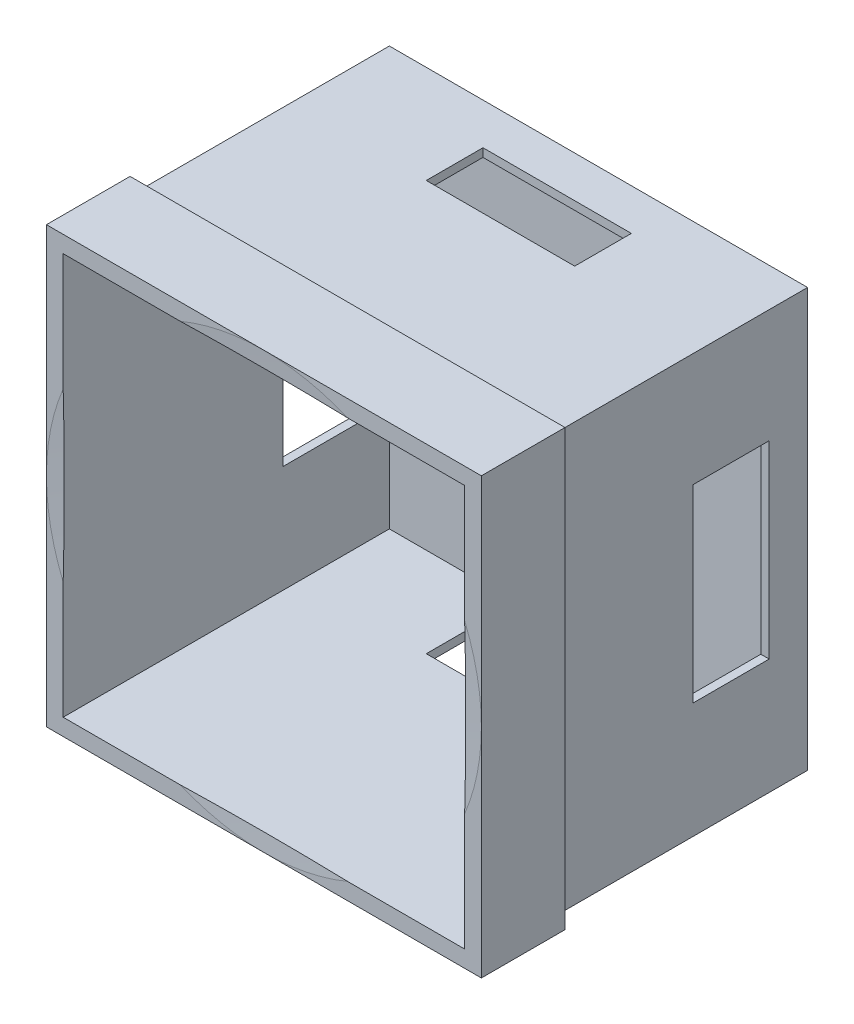
from build123d import *

# Parameters (mm, degrees)
SKETCH1_W           = 127
SKETCH1_H           = 76.2
BOSS_EXTRUDE1_DEPTH = 127
SHELL1_T            = -2.54
SKETCH2_W           = 132.08
SKETCH2_H           = 132.08
SKETCH2_W_2         = 121.92
SKETCH2_H_2         = 121.92
BOSS_EXTRUDE2_DEPTH = 25.4
SKETCH5_W           = 23.197534015
SKETCH5_H           = 57.422092124
CUT_EXTRUDE1_DEPTH  = 199.41286047
SKETCH6_W           = 45.064315034
SKETCH6_H           = 17.215386484
CUT_EXTRUDE2_DEPTH  = 199.41286047


with BuildPart() as part:
    # Sketch1 → Boss-Extrude1 (new body)
    with BuildSketch(Plane(origin=(0, 0, 0), x_dir=(1, 0, 0), z_dir=(0, 1, 0))):
        with Locations((-63.5, 38.1)):
            Rectangle(SKETCH1_W, SKETCH1_H)
    extrude(amount=BOSS_EXTRUDE1_DEPTH)

    # Shell1
    shell1_openings = [part.faces().sort_by_distance(p)[0] for p in [
        (-63.5, 63.5, 0),
    ]]
    offset(amount=SHELL1_T, openings=shell1_openings, kind=Kind.INTERSECTION)

    # Sketch2 → Boss-Extrude2 (add)
    with BuildSketch(Plane.XY):
        with Locations((-63.5, 63.5)):
            Rectangle(SKETCH2_W, SKETCH2_H)
        with Locations((-63.5, 63.5)):
            Rectangle(SKETCH2_W_2, SKETCH2_H_2, mode=Mode.SUBTRACT)
    extrude(amount=BOSS_EXTRUDE2_DEPTH)

    # Sketch3 → Cut-Revolve2 (revolve, cut)
    with BuildSketch(Plane.ZY.offset(63.5)):
        with BuildLine():
            ThreePointArc((23.19621529, 63.5), (1013.79621529, -927.1), (2004.39621529, 63.5))
            Line((2004.39621529, 63.5), (23.19621529, 63.5))
        make_face()
    revolve(axis=Axis((-63.5, 63.5, 2004.39621529), (0, 0, -1)), mode=Mode.SUBTRACT)

    # Sketch5 → Cut-Extrude1 (cut, through all)
    with BuildSketch(Plane.ZY.offset(127)):
        with Locations((-52.940293684, 63.810930306)):
            Rectangle(SKETCH5_W, SKETCH5_H)
    extrude(amount=-CUT_EXTRUDE1_DEPTH, mode=Mode.SUBTRACT)

    # Sketch6 → Cut-Extrude2 (cut, through all)
    with BuildSketch(Plane.XZ):
        with Locations((-63.5, -55.050992996)):
            Rectangle(SKETCH6_W, SKETCH6_H)
    extrude(amount=-CUT_EXTRUDE2_DEPTH, mode=Mode.SUBTRACT)


solid = part.part
